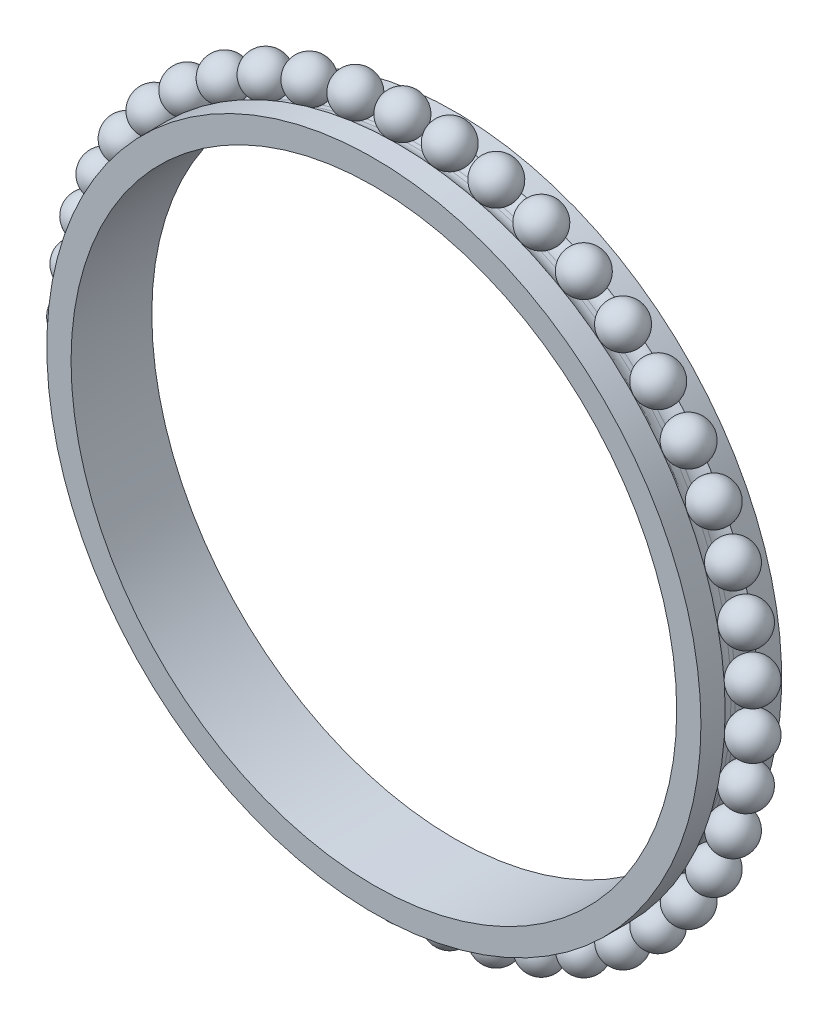
from build123d import *

# Parameters (mm, degrees)
SKETCH_1_R               = 39.5
SKETCH_1_R_2             = 37.5
EXTRUDE_4_DEPTH          = 10
EXTRUDE_START            = -3
SKETCH_5_R               = 40.5
SKETCH_5_R_2             = 39.5
EXTRUDE_5_DEPTH          = 3
FILLET_1_R               = 2
SKETCH_6_R               = 40.5
SKETCH_6_R_2             = 39.5
EXTRUDE_9_DEPTH          = 3
FILLET_2_R               = 2
PATTERN_CIRCULAR_1_COUNT = 45


with BuildPart() as part:
    # 草图1 → 凸台-拉伸4 (new body)
    with BuildSketch(Plane.XY):
        Circle(SKETCH_1_R)
        Circle(SKETCH_1_R_2, mode=Mode.SUBTRACT)
    extrude(amount=EXTRUDE_4_DEPTH)

    # 草图5 → 凸台-拉伸5 (add)
    with BuildSketch(Plane.XY.offset(10).offset(EXTRUDE_START)):
        Circle(SKETCH_5_R)
        Circle(SKETCH_5_R_2, mode=Mode.SUBTRACT)
    extrude(amount=EXTRUDE_5_DEPTH)

    # 圆角1
    # the kernel refuses this fillet: 2 mm, written as the material it adds along each edge
    with BuildSketch(Plane(origin=(0, 0, 7), x_dir=(1, 0, 0), z_dir=(0, -1, 0))) as fillet_1_piece_1:
        with BuildLine():
            CenterArc((41.5, -1.732050808), FILLET_1_R, 120, 60)
            Line((40.5, 0), (40.48, 0.034641016))
            ThreePointArc((40.48, 0.034641016), (40, 0.04), (39.5, 0.04))
            Line((39.5, 0.04), (39.46, 0))
            Line((39.46, 0), (39.46, -1.732050808))
            Line((39.46, -1.732050808), (39.5, -1.732050808))
        make_face()
    revolve(axis=Axis((0, 0, 7), (0, 0, 1)))

    # 草图6 → 凸台-拉伸9 (add)
    with BuildSketch(Plane(origin=(0, 0, 0), x_dir=(-1, 0, 0), z_dir=(0, 0, -1))):
        with Locations(Location((0, 0, 0), (0, 0, 180))):
            Circle(SKETCH_6_R)
        Circle(SKETCH_6_R_2, mode=Mode.SUBTRACT)
    extrude(amount=-EXTRUDE_9_DEPTH)

    # 圆角2
    # the kernel refuses this fillet: 2 mm, written as the material it adds along each edge
    with BuildSketch(Plane(origin=(0, 0, 3), x_dir=(1, 0, 0), z_dir=(0, -1, 0))) as fillet_2_piece_1:
        with BuildLine():
            CenterArc((41.5, 1.732050808), FILLET_2_R, 180, 60)
            Line((39.5, 1.732050808), (39.46, 1.732050808))
            Line((39.46, 1.732050808), (39.46, 0))
            Line((39.46, 0), (39.5, -0.04))
            ThreePointArc((39.5, -0.04), (40, -0.04), (40.48, -0.034641016))
            Line((40.48, -0.034641016), (40.5, 0))
        make_face()
    revolve(axis=Axis((0, 0, 3), (0, 0, 1)))


with BuildPart() as body_2:
    # 草图4 → 旋转1 (revolve)
    with BuildSketch(Plane.XY.offset(5)):
        with BuildLine():
            Line((-42, 2.5), (-42, -2.5))
            ThreePointArc((-42, -2.5), (-39.5, 0), (-42, 2.5))
        make_face()
    revolve(axis=Axis((-42, 2.5, 5), (0, -1, 0)))


with BuildPart() as pattern_circular_1_1:
    # 阵列(圆周)1: pattern copy
    add(body_2.part.rotate(Axis((0, 0, 0), (0, 0, 1)), 1 * 360 / PATTERN_CIRCULAR_1_COUNT))


with BuildPart() as pattern_circular_1_2:
    # 阵列(圆周)1: pattern copy
    add(body_2.part.rotate(Axis((0, 0, 0), (0, 0, 1)), 2 * 360 / PATTERN_CIRCULAR_1_COUNT))


with BuildPart() as pattern_circular_1_3:
    # 阵列(圆周)1: pattern copy
    add(body_2.part.rotate(Axis((0, 0, 0), (0, 0, 1)), 3 * 360 / PATTERN_CIRCULAR_1_COUNT))


with BuildPart() as pattern_circular_1_4:
    # 阵列(圆周)1: pattern copy
    add(body_2.part.rotate(Axis((0, 0, 0), (0, 0, 1)), 4 * 360 / PATTERN_CIRCULAR_1_COUNT))


with BuildPart() as pattern_circular_1_5:
    # 阵列(圆周)1: pattern copy
    add(body_2.part.rotate(Axis((0, 0, 0), (0, 0, 1)), 5 * 360 / PATTERN_CIRCULAR_1_COUNT))


with BuildPart() as pattern_circular_1_6:
    # 阵列(圆周)1: pattern copy
    add(body_2.part.rotate(Axis((0, 0, 0), (0, 0, 1)), 6 * 360 / PATTERN_CIRCULAR_1_COUNT))


with BuildPart() as pattern_circular_1_7:
    # 阵列(圆周)1: pattern copy
    add(body_2.part.rotate(Axis((0, 0, 0), (0, 0, 1)), 7 * 360 / PATTERN_CIRCULAR_1_COUNT))


with BuildPart() as pattern_circular_1_8:
    # 阵列(圆周)1: pattern copy
    add(body_2.part.rotate(Axis((0, 0, 0), (0, 0, 1)), 8 * 360 / PATTERN_CIRCULAR_1_COUNT))


with BuildPart() as pattern_circular_1_9:
    # 阵列(圆周)1: pattern copy
    add(body_2.part.rotate(Axis((0, 0, 0), (0, 0, 1)), 9 * 360 / PATTERN_CIRCULAR_1_COUNT))


with BuildPart() as pattern_circular_1_10:
    # 阵列(圆周)1: pattern copy
    add(body_2.part.rotate(Axis((0, 0, 0), (0, 0, 1)), 10 * 360 / PATTERN_CIRCULAR_1_COUNT))


with BuildPart() as pattern_circular_1_11:
    # 阵列(圆周)1: pattern copy
    add(body_2.part.rotate(Axis((0, 0, 0), (0, 0, 1)), 11 * 360 / PATTERN_CIRCULAR_1_COUNT))


with BuildPart() as pattern_circular_1_12:
    # 阵列(圆周)1: pattern copy
    add(body_2.part.rotate(Axis((0, 0, 0), (0, 0, 1)), 12 * 360 / PATTERN_CIRCULAR_1_COUNT))


with BuildPart() as pattern_circular_1_13:
    # 阵列(圆周)1: pattern copy
    add(body_2.part.rotate(Axis((0, 0, 0), (0, 0, 1)), 13 * 360 / PATTERN_CIRCULAR_1_COUNT))


with BuildPart() as pattern_circular_1_14:
    # 阵列(圆周)1: pattern copy
    add(body_2.part.rotate(Axis((0, 0, 0), (0, 0, 1)), 14 * 360 / PATTERN_CIRCULAR_1_COUNT))


with BuildPart() as pattern_circular_1_15:
    # 阵列(圆周)1: pattern copy
    add(body_2.part.rotate(Axis((0, 0, 0), (0, 0, 1)), 15 * 360 / PATTERN_CIRCULAR_1_COUNT))


with BuildPart() as pattern_circular_1_16:
    # 阵列(圆周)1: pattern copy
    add(body_2.part.rotate(Axis((0, 0, 0), (0, 0, 1)), 16 * 360 / PATTERN_CIRCULAR_1_COUNT))


with BuildPart() as pattern_circular_1_17:
    # 阵列(圆周)1: pattern copy
    add(body_2.part.rotate(Axis((0, 0, 0), (0, 0, 1)), 17 * 360 / PATTERN_CIRCULAR_1_COUNT))


with BuildPart() as pattern_circular_1_18:
    # 阵列(圆周)1: pattern copy
    add(body_2.part.rotate(Axis((0, 0, 0), (0, 0, 1)), 18 * 360 / PATTERN_CIRCULAR_1_COUNT))


with BuildPart() as pattern_circular_1_19:
    # 阵列(圆周)1: pattern copy
    add(body_2.part.rotate(Axis((0, 0, 0), (0, 0, 1)), 19 * 360 / PATTERN_CIRCULAR_1_COUNT))


with BuildPart() as pattern_circular_1_20:
    # 阵列(圆周)1: pattern copy
    add(body_2.part.rotate(Axis((0, 0, 0), (0, 0, 1)), 20 * 360 / PATTERN_CIRCULAR_1_COUNT))


with BuildPart() as pattern_circular_1_21:
    # 阵列(圆周)1: pattern copy
    add(body_2.part.rotate(Axis((0, 0, 0), (0, 0, 1)), 21 * 360 / PATTERN_CIRCULAR_1_COUNT))


with BuildPart() as pattern_circular_1_22:
    # 阵列(圆周)1: pattern copy
    add(body_2.part.rotate(Axis((0, 0, 0), (0, 0, 1)), 22 * 360 / PATTERN_CIRCULAR_1_COUNT))


with BuildPart() as pattern_circular_1_23:
    # 阵列(圆周)1: pattern copy
    add(body_2.part.rotate(Axis((0, 0, 0), (0, 0, 1)), 23 * 360 / PATTERN_CIRCULAR_1_COUNT))


with BuildPart() as pattern_circular_1_24:
    # 阵列(圆周)1: pattern copy
    add(body_2.part.rotate(Axis((0, 0, 0), (0, 0, 1)), 24 * 360 / PATTERN_CIRCULAR_1_COUNT))


with BuildPart() as pattern_circular_1_25:
    # 阵列(圆周)1: pattern copy
    add(body_2.part.rotate(Axis((0, 0, 0), (0, 0, 1)), 25 * 360 / PATTERN_CIRCULAR_1_COUNT))


with BuildPart() as pattern_circular_1_26:
    # 阵列(圆周)1: pattern copy
    add(body_2.part.rotate(Axis((0, 0, 0), (0, 0, 1)), 26 * 360 / PATTERN_CIRCULAR_1_COUNT))


with BuildPart() as pattern_circular_1_27:
    # 阵列(圆周)1: pattern copy
    add(body_2.part.rotate(Axis((0, 0, 0), (0, 0, 1)), 27 * 360 / PATTERN_CIRCULAR_1_COUNT))


with BuildPart() as pattern_circular_1_28:
    # 阵列(圆周)1: pattern copy
    add(body_2.part.rotate(Axis((0, 0, 0), (0, 0, 1)), 28 * 360 / PATTERN_CIRCULAR_1_COUNT))


with BuildPart() as pattern_circular_1_29:
    # 阵列(圆周)1: pattern copy
    add(body_2.part.rotate(Axis((0, 0, 0), (0, 0, 1)), 29 * 360 / PATTERN_CIRCULAR_1_COUNT))


with BuildPart() as pattern_circular_1_30:
    # 阵列(圆周)1: pattern copy
    add(body_2.part.rotate(Axis((0, 0, 0), (0, 0, 1)), 30 * 360 / PATTERN_CIRCULAR_1_COUNT))


with BuildPart() as pattern_circular_1_31:
    # 阵列(圆周)1: pattern copy
    add(body_2.part.rotate(Axis((0, 0, 0), (0, 0, 1)), 31 * 360 / PATTERN_CIRCULAR_1_COUNT))


with BuildPart() as pattern_circular_1_32:
    # 阵列(圆周)1: pattern copy
    add(body_2.part.rotate(Axis((0, 0, 0), (0, 0, 1)), 32 * 360 / PATTERN_CIRCULAR_1_COUNT))


with BuildPart() as pattern_circular_1_33:
    # 阵列(圆周)1: pattern copy
    add(body_2.part.rotate(Axis((0, 0, 0), (0, 0, 1)), 33 * 360 / PATTERN_CIRCULAR_1_COUNT))


with BuildPart() as pattern_circular_1_34:
    # 阵列(圆周)1: pattern copy
    add(body_2.part.rotate(Axis((0, 0, 0), (0, 0, 1)), 34 * 360 / PATTERN_CIRCULAR_1_COUNT))


with BuildPart() as pattern_circular_1_35:
    # 阵列(圆周)1: pattern copy
    add(body_2.part.rotate(Axis((0, 0, 0), (0, 0, 1)), 35 * 360 / PATTERN_CIRCULAR_1_COUNT))


with BuildPart() as pattern_circular_1_36:
    # 阵列(圆周)1: pattern copy
    add(body_2.part.rotate(Axis((0, 0, 0), (0, 0, 1)), 36 * 360 / PATTERN_CIRCULAR_1_COUNT))


with BuildPart() as pattern_circular_1_37:
    # 阵列(圆周)1: pattern copy
    add(body_2.part.rotate(Axis((0, 0, 0), (0, 0, 1)), 37 * 360 / PATTERN_CIRCULAR_1_COUNT))


with BuildPart() as pattern_circular_1_38:
    # 阵列(圆周)1: pattern copy
    add(body_2.part.rotate(Axis((0, 0, 0), (0, 0, 1)), 38 * 360 / PATTERN_CIRCULAR_1_COUNT))


with BuildPart() as pattern_circular_1_39:
    # 阵列(圆周)1: pattern copy
    add(body_2.part.rotate(Axis((0, 0, 0), (0, 0, 1)), 39 * 360 / PATTERN_CIRCULAR_1_COUNT))


with BuildPart() as pattern_circular_1_40:
    # 阵列(圆周)1: pattern copy
    add(body_2.part.rotate(Axis((0, 0, 0), (0, 0, 1)), 40 * 360 / PATTERN_CIRCULAR_1_COUNT))


with BuildPart() as pattern_circular_1_41:
    # 阵列(圆周)1: pattern copy
    add(body_2.part.rotate(Axis((0, 0, 0), (0, 0, 1)), 41 * 360 / PATTERN_CIRCULAR_1_COUNT))


with BuildPart() as pattern_circular_1_42:
    # 阵列(圆周)1: pattern copy
    add(body_2.part.rotate(Axis((0, 0, 0), (0, 0, 1)), 42 * 360 / PATTERN_CIRCULAR_1_COUNT))


with BuildPart() as pattern_circular_1_43:
    # 阵列(圆周)1: pattern copy
    add(body_2.part.rotate(Axis((0, 0, 0), (0, 0, 1)), 43 * 360 / PATTERN_CIRCULAR_1_COUNT))


with BuildPart() as pattern_circular_1_44:
    # 阵列(圆周)1: pattern copy
    add(body_2.part.rotate(Axis((0, 0, 0), (0, 0, 1)), 44 * 360 / PATTERN_CIRCULAR_1_COUNT))


solid = Compound([part.part, body_2.part, pattern_circular_1_1.part, pattern_circular_1_2.part, pattern_circular_1_3.part, pattern_circular_1_4.part, pattern_circular_1_5.part, pattern_circular_1_6.part, pattern_circular_1_7.part, pattern_circular_1_8.part, pattern_circular_1_9.part, pattern_circular_1_10.part, pattern_circular_1_11.part, pattern_circular_1_12.part, pattern_circular_1_13.part, pattern_circular_1_14.part, pattern_circular_1_15.part, pattern_circular_1_16.part, pattern_circular_1_17.part, pattern_circular_1_18.part, pattern_circular_1_19.part, pattern_circular_1_20.part, pattern_circular_1_21.part, pattern_circular_1_22.part, pattern_circular_1_23.part, pattern_circular_1_24.part, pattern_circular_1_25.part, pattern_circular_1_26.part, pattern_circular_1_27.part, pattern_circular_1_28.part, pattern_circular_1_29.part, pattern_circular_1_30.part, pattern_circular_1_31.part, pattern_circular_1_32.part, pattern_circular_1_33.part, pattern_circular_1_34.part, pattern_circular_1_35.part, pattern_circular_1_36.part, pattern_circular_1_37.part, pattern_circular_1_38.part, pattern_circular_1_39.part, pattern_circular_1_40.part, pattern_circular_1_41.part, pattern_circular_1_42.part, pattern_circular_1_43.part, pattern_circular_1_44.part])
